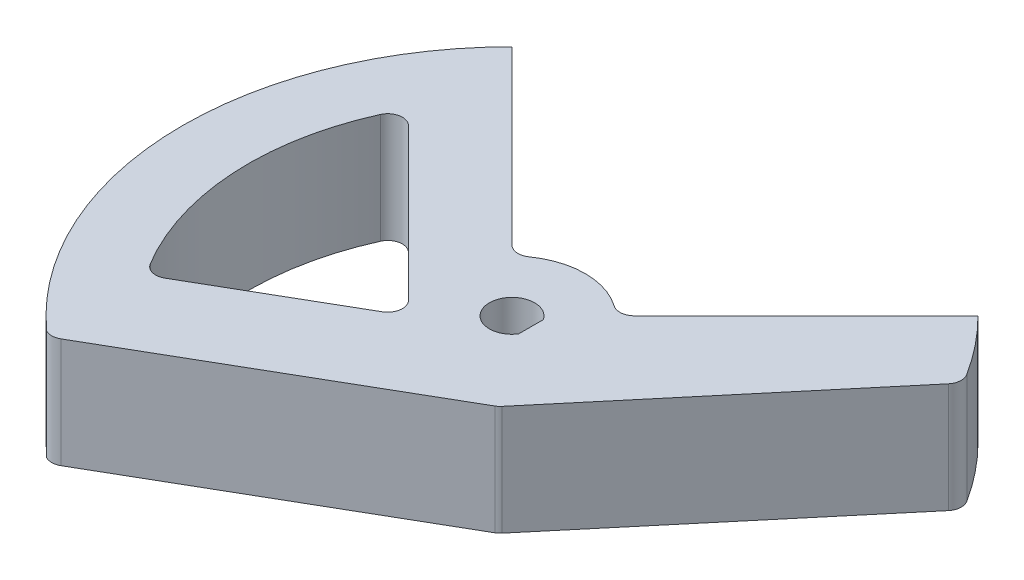
from build123d import *

# Parameters (mm, degrees)
SKETCH1_R                  = 3
BOSS_EXTRUDE1_DEPTH        = 15
SHAFT_START                = -15
SHAFT_D_DEPTH              = 15
CUT_EXTRUDE1_DEPTH         = 66.3834841531101
BOSS_EXTRUDE3_DEPTH        = 0.9
CUT_EXTRUDE2_DEPTH         = 59.56795722653927
SHAFT_HOLE_EXPANSION_DEPTH = 59.56795722653927
CUT_EXTRUDE4_DEPTH         = 59.56795722653927
FILLET1_R                  = 2


with BuildPart() as part:
    # Sketch1 → Boss-Extrude1 (new body)
    with BuildSketch(Plane(origin=(0, 0, 0), x_dir=(1, 0, 0), z_dir=(0, 1, 0))):
        with BuildLine():
            Line((-31.81980515339447, 31.819805153394796), (-7.071067811865444, 7.071067811865506))
            ThreePointArc((-7.071067811865444, 7.071067811865506), (4.724e-14, 10.000000000000002), (7.071067811865511, 7.071067811865442))
            Line((7.071067811865511, 7.071067811865442), (31.819805153394796, 31.819805153394476))
            ThreePointArc((31.819805153394796, 31.819805153394476), (-2.4807e-13, -44.99999999999999), (-31.81980515339447, 31.819805153394796))
        make_face()
        with Locations(Location((0, 0, 0), (0, 0, 270))):
            Circle(SKETCH1_R, mode=Mode.SUBTRACT)
    extrude(amount=BOSS_EXTRUDE1_DEPTH)

    # Sketch2 → Shaft D (add)
    with BuildSketch(Plane(origin=(0, 15, 0), x_dir=(1, 0, 0), z_dir=(0, 1, 0)).offset(SHAFT_START)):
        with BuildLine():
            Line((2.499999999999999, 1.6583123951777017), (2.499999999999999, -1.6583123951777017))
            ThreePointArc((2.499999999999999, -1.6583123951777017), (3.0000000000000004, 0), (2.499999999999999, 1.6583123951777017))
        make_face()
    extrude(amount=SHAFT_D_DEPTH)

    # Sketch4 → Cut-Extrude1 (cut, through all)
    with BuildSketch(Plane(origin=(0, 15, 0), x_dir=(1, 0, 0), z_dir=(0, 1, 0))):
        with BuildLine():
            Line((11.490666646784653, -9.641814145298108), (45.50378986806941, 30.893447649017453))
            ThreePointArc((45.50378986806941, 30.893447649017453), (34.99275019793601, -42.43238661193652), (-38.99293957205545, -38.78853778540811))
            Line((-38.99293957205545, -38.78853778540811), (11.490666646784653, -9.641814145298108))
        make_face()
    extrude(amount=-CUT_EXTRUDE1_DEPTH, mode=Mode.SUBTRACT)

    # Sketch6 → Boss-Extrude3 (add)
    with BuildSketch(Plane(origin=(7.0476946558942295, 0, 12.206965220240622), x_dir=(0.8660254037844414, 0, -0.4999999999999952), z_dir=(0.4999999999999952, 0, 0.8660254037844414))):
        Polygon((-42.73546536717619, 15), (5.130302149885087, 15), (5.130302149885089, 0), (-42.73546536717619, 0), align=None)
    extrude(amount=BOSS_EXTRUDE3_DEPTH)

    # Sketch7 → Cut-Extrude2 (cut, through all)
    with BuildSketch(Plane(origin=(0, 15, 0), x_dir=(1, 0, 0), z_dir=(0, 1, 0))):
        with BuildLine():
            Line((-31.525106333140414, 17.38297070940953), (-7.071067811865441, -7.07106781186544))
            Line((-7.071067811865441, -7.07106781186544), (-29.802141727564482, -20.19485945606356))
            ThreePointArc((-29.802141727564482, -20.19485945606356), (-35.962218628181056, -1.6488879097460596), (-31.525106333140414, 17.38297070940953))
        make_face()
    extrude(amount=-CUT_EXTRUDE2_DEPTH, mode=Mode.SUBTRACT)

    # Sketch9 → Shaft Hole Expansion (cut, through all)
    with BuildSketch(Plane(origin=(0, 15, 0), x_dir=(1, 0, 0), z_dir=(0, 1, 0))):
        with BuildLine():
            Line((2.5899999999999985, 1.685229954635274), (2.5899999999999985, -1.6852299546352736))
            ThreePointArc((2.5899999999999985, -1.6852299546352736), (-3.09, 3.8e-16), (2.5899999999999985, 1.685229954635274))
        make_face()
    extrude(amount=-SHAFT_HOLE_EXPANSION_DEPTH, mode=Mode.SUBTRACT)

    # Sketch10 → Cut-Extrude4 (cut, through all)
    with BuildSketch(Plane(origin=(0, 15, 0), x_dir=(1, 0, 0), z_dir=(0, 1, 0))):
        Polygon((11.49066664678465, -9.641814145298104), (7.493411323151681, -14.405557537754012), (21.666837443070385, -15.28946640390601), align=None)
    extrude(amount=-CUT_EXTRUDE4_DEPTH, mode=Mode.SUBTRACT)

    # Fillet1
    # the kernel refuses this fillet: 2 mm, written as the material it adds along each edge
    with BuildSketch(Plane(origin=(-29.802141727564482, 15, 20.19485945606356), x_dir=(0.8660254037844384, 0, -0.5000000000000004), z_dir=(0, -1, 0))) as fillet1_piece_1:
        with BuildLine():
            CenterArc((1.9119296968147805, -2.000000000000001), FILLET1_R, 90.00000000000006, 89.00874965826159)
            ThreePointArc((-0.08777100050710222, -1.9654005617043746), (-0.05731387291771985, -0.9821005956140282), (0, 0))
            Line((0, 0), (1.911929696814779, 4e-17))
        make_face()
    extrude(amount=15)
    with BuildSketch(Plane(origin=(-31.525106333140414, 15, -17.382970709409527), x_dir=(-0.44779859611608247, 0, 0.8941344514760997), z_dir=(0, -1, 0))) as fillet1_piece_2:
        with BuildLine():
            CenterArc((2.77241732034655, -1.9984307521616007), FILLET1_R, 87.73015185982399, 110.66731649351249)
            Line((0.8746374046450249, -2.6296449721851296), (0, 0))
            ThreePointArc((0, 0), (1.4258146218925176, 0.02824646109120102), (2.8516292437850255, 6e-17))
        make_face()
    extrude(amount=15)
    with BuildSketch(Plane(origin=(-7.071067811865441, 15, 7.07106781186544), x_dir=(-0.8660254037844387, 0, 0.4999999999999999), z_dir=(0, -1, 0))) as fillet1_piece_3:
        with BuildLine():
            CenterArc((FILLET1_R * 1.30322537284, FILLET1_R), FILLET1_R, 165.00000000000003, 104.99999999999997)
            Line((FILLET1_R * 0.337299546552, FILLET1_R * 1.2588190451), (0, 0))
            Line((0, 0), (FILLET1_R * 1.30322537284, 1e-17))
        make_face()
    extrude(amount=15)
    with BuildSketch(Plane(origin=(-7.071067811865445, 0, -7.071067811865506), x_dir=(-0.7071067811865437, 0, -0.7071067811865515), z_dir=(0, 1, 0))) as fillet1_piece_4:
        with BuildLine():
            CenterArc((1.8321595661992367, -2), FILLET1_R, 89.99999999999999, 80.40593177313956)
            ThreePointArc((-0.13986702816730157, -1.666666666666667), (-0.0350281054503974, -0.8362626027968331), (0, 0))
            Line((0, 0), (1.8321595661992371, 5e-17))
        make_face()
    extrude(amount=15)
    with BuildSketch(Plane(origin=(7.071067811865512, 0, -7.071067811865442), x_dir=(0.7071067811865507, 0, -0.7071067811865444), z_dir=(0, 1, 0))) as fillet1_piece_5:
        with BuildLine():
            CenterArc((1.8321595661992343, 2.0000000000000004), FILLET1_R, 189.59406822686037, 80.40593177313957)
            ThreePointArc((-0.139867028167305, 1.6666666666666698), (-0.03502810545039883, 0.8362626027968333), (0, 0))
            Line((0, 0), (1.8321595661992325, 4e-17))
        make_face()
    extrude(amount=15)
    # the kernel refuses this fillet: 2 mm, written as the material it takes off along each edge
    with BuildSketch(Plane(origin=(-29.512303994630546, -4.175823272127531, 34.35412076723451), x_dir=(-0.49999999999865496, 0, -0.8660254037852152), z_dir=(0, 1, 0))) as fillet1_2_piece_1:
        with BuildLine():
            CenterArc((2.0000000000025833, -1.6703293088479174), FILLET1_R, 123.36701296928852, 56.63298703080011)
            Line((2.58454e-12, -1.6703293088510118), (0, 0))
            Line((0, 0), (0.9000000000009275, 2e-17))
        make_face()
    extrude(amount=23.35164654425506, mode=Mode.SUBTRACT)
    with BuildSketch(Plane(origin=(9.799219929370043, -0.8816349035423467, 11.657601847458647), x_dir=(0.6427876096865316, 0, -0.7660444431189845), z_dir=(0, 1, 0))) as fillet1_2_piece_2:
        with BuildLine():
            CenterArc((FILLET1_R * 0.176326980708, FILLET1_R), FILLET1_R, 249.99999999999906, 20.000000000000284)
            Line((-FILLET1_R * 0.165693162617, FILLET1_R * 0.0603073792141), (0, 0))
            Line((0, 0), (FILLET1_R * 0.176326980708, 1e-17))
        make_face()
    extrude(amount=16.763269807084693, mode=Mode.SUBTRACT)
    with BuildSketch(Plane(origin=(38.76183530710732, 18.67919870008775, -22.858699079883973), x_dir=(-0.5219883581091025, 0, -0.8529526094681715), z_dir=(0, -1, 0))) as fillet1_2_piece_3:
        with BuildLine():
            CenterArc((1.4389754915898811, -1.9997325944085071), FILLET1_R, 89.06305798679442, 72.40266339187922)
            Line((-0.45729180864609936, -1.363988678939587), (0, 0))
            ThreePointArc((0, 0), (0.7358397400175548, 0.00601662580861232), (1.4716794800350999, 0))
        make_face()
    extrude(amount=22.3583974001755, mode=Mode.SUBTRACT)


solid = part.part
